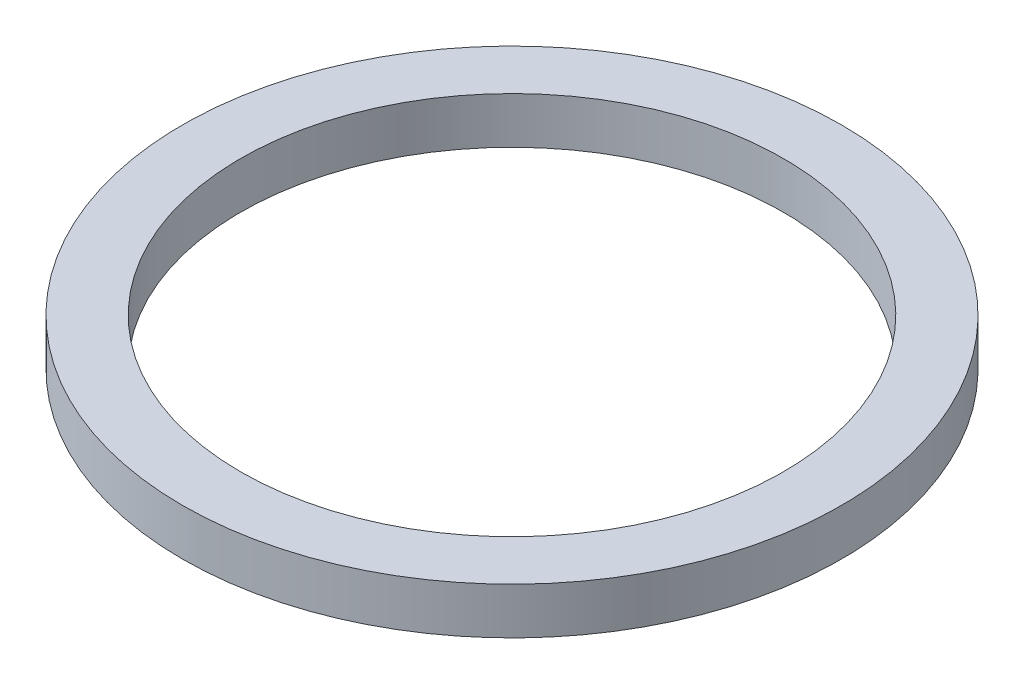
from build123d import *

# Parameters (mm, degrees)
SKETCH1_R           = 42.5
BOSS_EXTRUDE1_DEPTH = 6
SKETCH2_R           = 35
CUT_EXTRUDE1_DEPTH  = 61.402814504


with BuildPart() as part:
    # Sketch1 → Boss-Extrude1 (new body)
    with BuildSketch(Plane(origin=(0, 0, 0), x_dir=(1, 0, 0), z_dir=(0, 1, 0))):
        Circle(SKETCH1_R)
    extrude(amount=BOSS_EXTRUDE1_DEPTH)

    # Sketch2 → Cut-Extrude1 (cut, through all)
    with BuildSketch(Plane(origin=(0, 0, 0), x_dir=(1, 0, 0), z_dir=(0, 1, 0))):
        Circle(SKETCH2_R)
    extrude(amount=CUT_EXTRUDE1_DEPTH, mode=Mode.SUBTRACT)


solid = part.part
